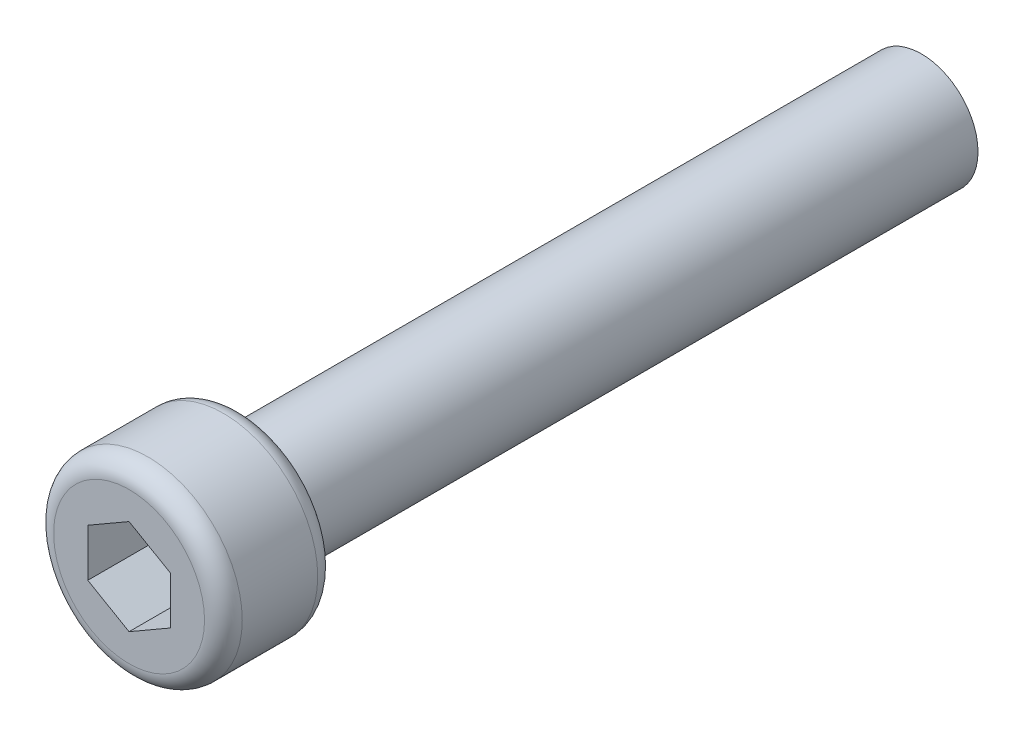
from build123d import *

# Parameters (mm, degrees)
SKETCH1_R           = 1.5
BOSS_EXTRUDE1_DEPTH = 18
SKETCH2_R           = 2.5
BOSS_EXTRUDE2_DEPTH = 3
FILLET1_R           = 0.5
CUT_EXTRUDE1_DEPTH  = 2


with BuildPart() as part:
    # Sketch1 → Boss-Extrude1 (new body)
    with BuildSketch(Plane.XY):
        with Locations((0, 1.584180911)):
            Circle(SKETCH1_R)
    extrude(amount=-BOSS_EXTRUDE1_DEPTH)

    # Sketch2 → Boss-Extrude2 (add)
    with BuildSketch(Plane.XY):
        with Locations((0, 1.584180911)):
            Circle(SKETCH2_R)
    extrude(amount=BOSS_EXTRUDE2_DEPTH)

    # Fillet1
    fillet1_edges = [part.edges().sort_by_distance(p)[0] for p in [
        (-2.5, 1.584180911, 3),
        (-2.5, 1.584180911, 0),
    ]]
    fillet(fillet1_edges, radius=FILLET1_R)

    # Sketch3 → Cut-Extrude1 (cut)
    with BuildSketch(Plane.XY.offset(3)):
        Polygon((0, 0.320652174), (1.094247985, 0.952416543), (1.094247985, 2.21594528), (0, 2.847709649), (-1.094247985, 2.21594528), (-1.094247985, 0.952416543), align=None)
    extrude(amount=-CUT_EXTRUDE1_DEPTH, mode=Mode.SUBTRACT)


solid = part.part
